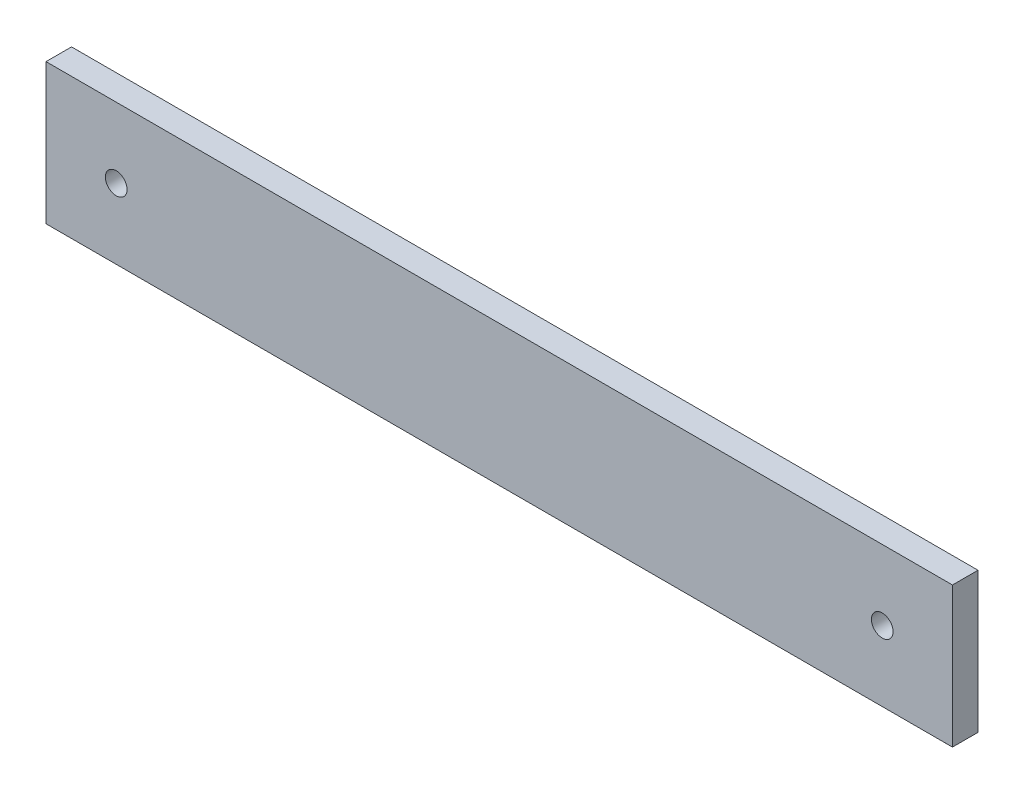
from build123d import *

# Parameters (mm, degrees)
SKETCH_1_W      = 142
SKETCH_1_H      = 22
SKETCH_1_R      = 1.7
EXTRUDE_1_DEPTH = 2


with BuildPart() as part:
    # 草图1 → 凸台-拉伸1 (new, symmetric)
    with BuildSketch(Plane.XY):
        with Locations((60, 0)):
            Rectangle(SKETCH_1_W, SKETCH_1_H)
        Circle(SKETCH_1_R, mode=Mode.SUBTRACT)
        with Locations((120, 0)):
            Circle(SKETCH_1_R, mode=Mode.SUBTRACT)
    extrude(amount=EXTRUDE_1_DEPTH, both=True)


solid = part.part
